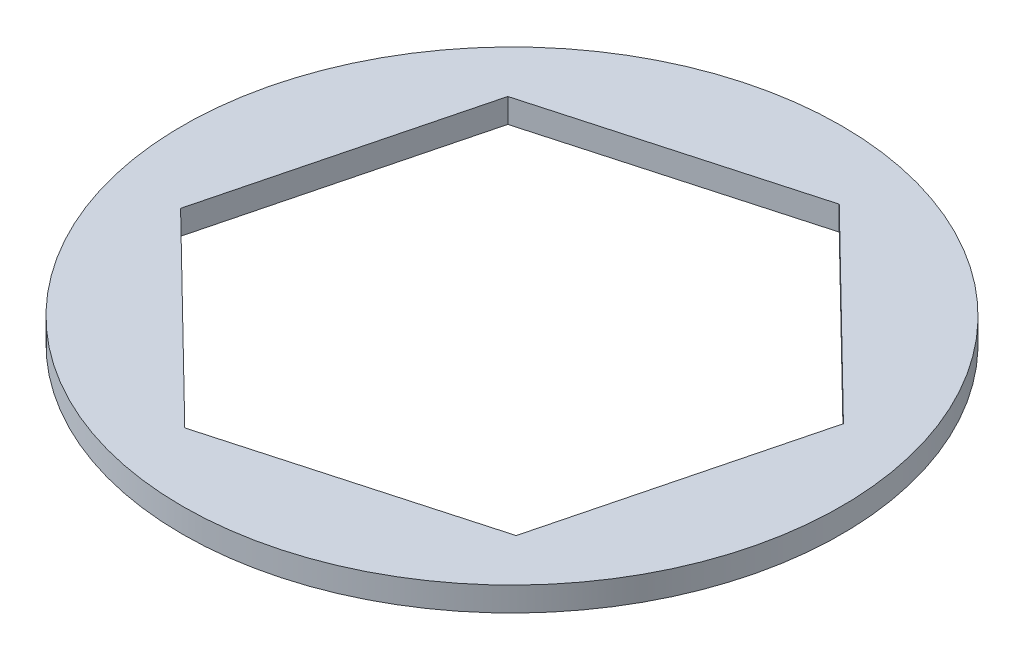
from build123d import *

# Parameters (mm, degrees)
SKETCH1_R           = 9.525
BOSS_EXTRUDE1_DEPTH = 0.7


with BuildPart() as part:
    # Sketch1 → Boss-Extrude1 (new body)
    with BuildSketch(Plane(origin=(0, 0, 0), x_dir=(1, 0, 0), z_dir=(0, 1, 0))):
        Circle(SKETCH1_R)
        Polygon((1.928947981, 7.529119538), (-5.555934798, 5.435077723), (-7.484882779, -2.094041815), (-1.928947981, -7.529119538), (5.555934798, -5.435077723), (7.484882779, 2.094041815), align=None, mode=Mode.SUBTRACT)
    extrude(amount=BOSS_EXTRUDE1_DEPTH)


solid = part.part
